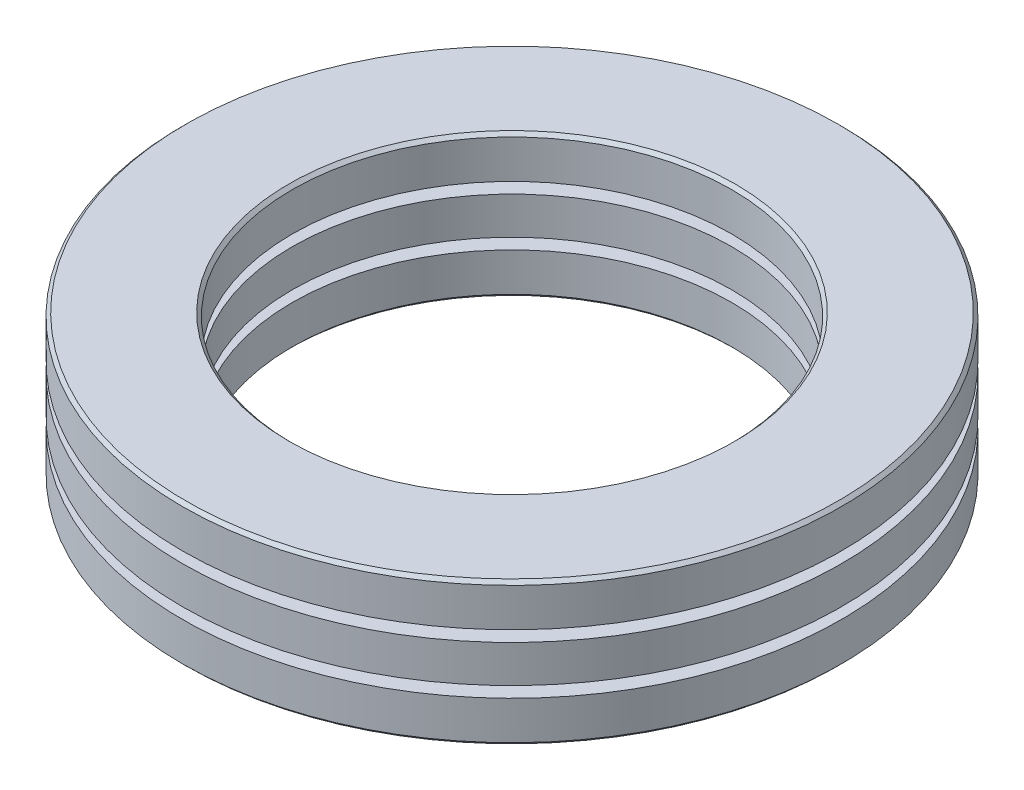
from build123d import *

# Parameters (mm, degrees)
SKETCH1_R           = 30
SKETCH1_R_2         = 20
BOSS_EXTRUDE1_DEPTH = 3.8
SKETCH2_R           = 30
SKETCH2_R_2         = 20
BOSS_EXTRUDE2_DEPTH = 3.4
SKETCH3_R           = 30
SKETCH3_R_2         = 20
BOSS_EXTRUDE3_DEPTH = 3.8
CIRPATTERN1_COUNT   = 18
CIRPATTERN4_COUNT   = 18
CHAMFER1_SIZE       = 0.3
CHAMFER2_SIZE       = 0.3


with BuildPart() as part:
    # Sketch1 → Boss-Extrude1 (new body)
    with BuildSketch(Plane(origin=(0, 0, 0), x_dir=(1, 0, 0), z_dir=(0, 1, 0))):
        Circle(SKETCH1_R)
        Circle(SKETCH1_R_2, mode=Mode.SUBTRACT)
    extrude(amount=BOSS_EXTRUDE1_DEPTH)

    # Chamfer1
    chamfer1_edges = [part.edges().sort_by_distance(p)[0] for p in [
        (-30, 0, 0),
        (-20, 0, 0),
    ]]
    chamfer(chamfer1_edges, length=CHAMFER1_SIZE)


with BuildPart() as body_2:
    # Sketch2 → Boss-Extrude2 (new body)
    with BuildSketch(Plane(origin=(0, 4.8, 0), x_dir=(1, 0, 0), z_dir=(0, 1, 0))):
        Circle(SKETCH2_R)
        Circle(SKETCH2_R_2, mode=Mode.SUBTRACT)
    extrude(amount=BOSS_EXTRUDE2_DEPTH)

    # Sketch4 → Cut-Revolve2 (revolve, cut)
    with BuildSketch(Plane.XY):
        with BuildLine():
            ThreePointArc((-22.3, 6.5), (-25, 9.2), (-27.7, 6.5))
            Line((-27.7, 6.5), (-22.3, 6.5))
        make_face()
    cut_revolve2 = revolve(axis=Axis((-27.7, 6.5, 0), (1, 0, 0)), mode=Mode.SUBTRACT)

    # CirPattern1: Cut-Revolve2 ×18 about axis
    cirpattern1_axis = Axis((0, 9.2, 0), (0, 1, 0))
    for i in range(1, CIRPATTERN1_COUNT):
        add(cut_revolve2.rotate(cirpattern1_axis, i * 360 / CIRPATTERN1_COUNT), mode=Mode.SUBTRACT)


with BuildPart() as body_3:
    # Sketch3 → Boss-Extrude3 (new body)
    with BuildSketch(Plane(origin=(0, 13, 0), x_dir=(-1, 0, 0), z_dir=(0, -1, 0))):
        Circle(SKETCH3_R)
        Circle(SKETCH3_R_2, mode=Mode.SUBTRACT)
    extrude(amount=BOSS_EXTRUDE3_DEPTH)

    # Chamfer2
    chamfer2_edges = [body_3.edges().sort_by_distance(p)[0] for p in [
        (30, 13, 0),
        (20, 13, 0),
    ]]
    chamfer(chamfer2_edges, length=CHAMFER2_SIZE)


with BuildPart() as body_4:
    # Sketch4<3> → Revolve1 (revolve)
    with BuildSketch(Plane.XY):
        with BuildLine():
            Line((-27.7, 6.5), (-22.3, 6.5))
            ThreePointArc((-22.3, 6.5), (-25, 9.2), (-27.7, 6.5))
        make_face()
    revolve(axis=Axis((-27.7, 6.5, 0), (1, 0, 0)))


with BuildPart() as cirpattern4_1:
    # CirPattern4: pattern copy
    add(body_4.part.rotate(Axis((0, 9.2, 0), (0, 1, 0)), 1 * 360 / CIRPATTERN4_COUNT))


with BuildPart() as cirpattern4_2:
    # CirPattern4: pattern copy
    add(body_4.part.rotate(Axis((0, 9.2, 0), (0, 1, 0)), 2 * 360 / CIRPATTERN4_COUNT))


with BuildPart() as cirpattern4_3:
    # CirPattern4: pattern copy
    add(body_4.part.rotate(Axis((0, 9.2, 0), (0, 1, 0)), 3 * 360 / CIRPATTERN4_COUNT))


with BuildPart() as cirpattern4_4:
    # CirPattern4: pattern copy
    add(body_4.part.rotate(Axis((0, 9.2, 0), (0, 1, 0)), 4 * 360 / CIRPATTERN4_COUNT))


with BuildPart() as cirpattern4_5:
    # CirPattern4: pattern copy
    add(body_4.part.rotate(Axis((0, 9.2, 0), (0, 1, 0)), 5 * 360 / CIRPATTERN4_COUNT))


with BuildPart() as cirpattern4_6:
    # CirPattern4: pattern copy
    add(body_4.part.rotate(Axis((0, 9.2, 0), (0, 1, 0)), 6 * 360 / CIRPATTERN4_COUNT))


with BuildPart() as cirpattern4_7:
    # CirPattern4: pattern copy
    add(body_4.part.rotate(Axis((0, 9.2, 0), (0, 1, 0)), 7 * 360 / CIRPATTERN4_COUNT))


with BuildPart() as cirpattern4_8:
    # CirPattern4: pattern copy
    add(body_4.part.rotate(Axis((0, 9.2, 0), (0, 1, 0)), 8 * 360 / CIRPATTERN4_COUNT))


with BuildPart() as cirpattern4_9:
    # CirPattern4: pattern copy
    add(body_4.part.rotate(Axis((0, 9.2, 0), (0, 1, 0)), 9 * 360 / CIRPATTERN4_COUNT))


with BuildPart() as cirpattern4_10:
    # CirPattern4: pattern copy
    add(body_4.part.rotate(Axis((0, 9.2, 0), (0, 1, 0)), 10 * 360 / CIRPATTERN4_COUNT))


with BuildPart() as cirpattern4_11:
    # CirPattern4: pattern copy
    add(body_4.part.rotate(Axis((0, 9.2, 0), (0, 1, 0)), 11 * 360 / CIRPATTERN4_COUNT))


with BuildPart() as cirpattern4_12:
    # CirPattern4: pattern copy
    add(body_4.part.rotate(Axis((0, 9.2, 0), (0, 1, 0)), 12 * 360 / CIRPATTERN4_COUNT))


with BuildPart() as cirpattern4_13:
    # CirPattern4: pattern copy
    add(body_4.part.rotate(Axis((0, 9.2, 0), (0, 1, 0)), 13 * 360 / CIRPATTERN4_COUNT))


with BuildPart() as cirpattern4_14:
    # CirPattern4: pattern copy
    add(body_4.part.rotate(Axis((0, 9.2, 0), (0, 1, 0)), 14 * 360 / CIRPATTERN4_COUNT))


with BuildPart() as cirpattern4_15:
    # CirPattern4: pattern copy
    add(body_4.part.rotate(Axis((0, 9.2, 0), (0, 1, 0)), 15 * 360 / CIRPATTERN4_COUNT))


with BuildPart() as cirpattern4_16:
    # CirPattern4: pattern copy
    add(body_4.part.rotate(Axis((0, 9.2, 0), (0, 1, 0)), 16 * 360 / CIRPATTERN4_COUNT))


with BuildPart() as cirpattern4_17:
    # CirPattern4: pattern copy
    add(body_4.part.rotate(Axis((0, 9.2, 0), (0, 1, 0)), 17 * 360 / CIRPATTERN4_COUNT))


solid = Compound([part.part, body_2.part, body_3.part, body_4.part, cirpattern4_1.part, cirpattern4_2.part, cirpattern4_3.part, cirpattern4_4.part, cirpattern4_5.part, cirpattern4_6.part, cirpattern4_7.part, cirpattern4_8.part, cirpattern4_9.part, cirpattern4_10.part, cirpattern4_11.part, cirpattern4_12.part, cirpattern4_13.part, cirpattern4_14.part, cirpattern4_15.part, cirpattern4_16.part, cirpattern4_17.part])
